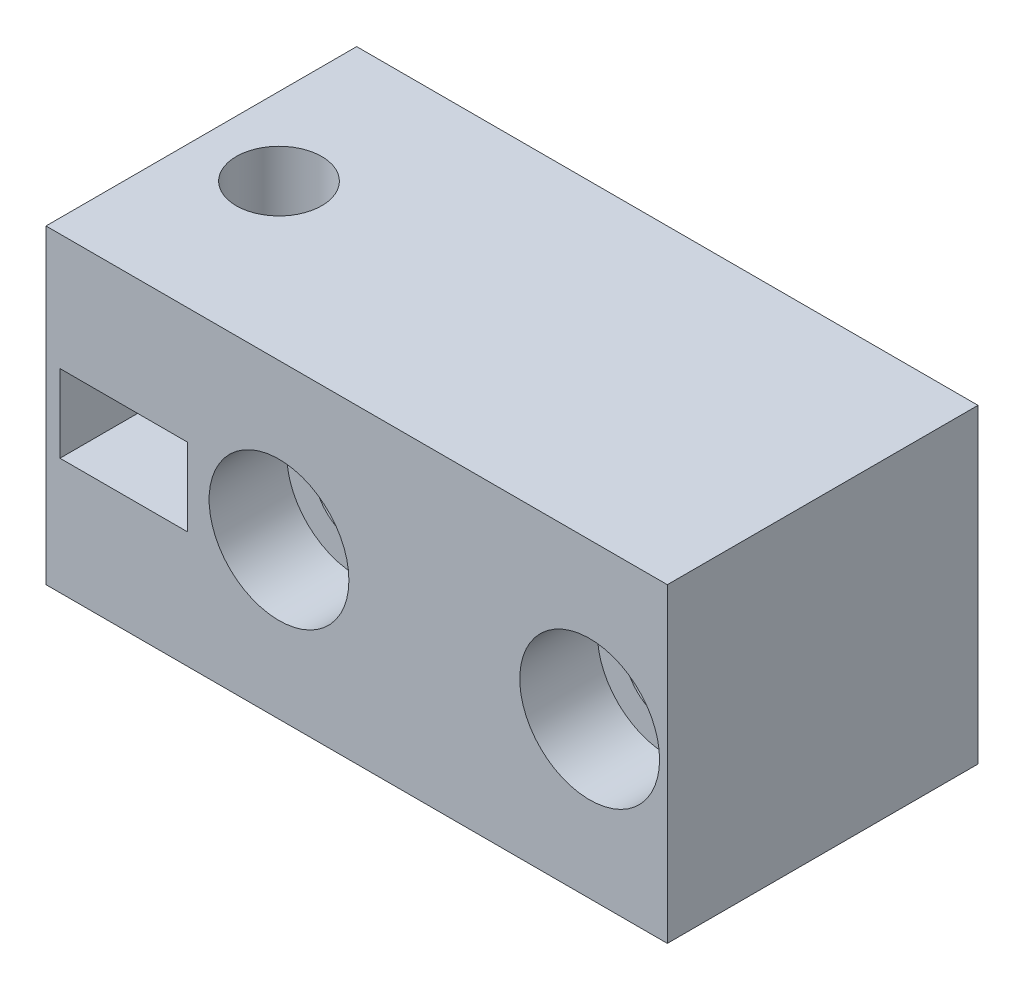
from build123d import *

# Parameters (mm, degrees)
SKETCH1_W           = 50
SKETCH1_H           = 20
BOSS_EXTRUDE1_DEPTH = 20
SKETCH2_R           = 2.75
SKETCH2_W           = 8.2
SKETCH2_H           = 5
CUT_EXTRUDE1_DEPTH  = 58.445626465
SKETCH3_R           = 2.75
CUT_EXTRUDE2_DEPTH  = 58.445626465
BOSS_EXTRUDE2_REACH = 57.283
SKETCH5_W           = 8
SKETCH5_H           = 6
BOSS_EXTRUDE3_DEPTH = 3
SKETCH6_R           = 4.5
CUT_EXTRUDE3_DEPTH  = 5
SKETCH7_W           = 10
SKETCH7_H           = 20
CUT_EXTRUDE4_DEPTH  = 59.557663888


with BuildPart() as part:
    # Sketch1 → Boss-Extrude1 (new body)
    with BuildSketch(Plane.XY):
        with Locations((25, 10)):
            Rectangle(SKETCH1_W, SKETCH1_H)
    extrude(amount=BOSS_EXTRUDE1_DEPTH)

    # Sketch2 → Cut-Extrude1 (cut, through all)
    with BuildSketch(Plane.XY.offset(20)):
        with Locations((25, 10)):
            Circle(SKETCH2_R)
        with Locations((45, 10)):
            Circle(SKETCH2_R)
        with Locations((15, 10)):
            Rectangle(SKETCH2_W, SKETCH2_H)
    extrude(amount=-CUT_EXTRUDE1_DEPTH, mode=Mode.SUBTRACT)

    # Sketch3 → Cut-Extrude2 (cut, through all)
    with BuildSketch(Plane(origin=(0, 20, 0), x_dir=(1, 0, 0), z_dir=(0, 1, 0))):
        with Locations((15, -10)):
            Circle(SKETCH3_R)
    extrude(amount=-CUT_EXTRUDE2_DEPTH, mode=Mode.SUBTRACT)

    # Sketch4 → Boss-Extrude2 (add, up to next)
    with BuildSketch(Plane(origin=(0, 7.5, 0), x_dir=(1, 0, 0), z_dir=(0, 1, 0)), mode=Mode.PRIVATE) as boss_extrude2_sk1:
        Polygon((19.1, -7.5), (15.1, -5.133920143), (10.9, -7.5), (10.9, 0), (19.1, 0), align=None)
    boss_extrude2_tool1 = extrude(boss_extrude2_sk1.sketch, amount=BOSS_EXTRUDE2_REACH, mode=Mode.PRIVATE) - part.part
    add(boss_extrude2_tool1.solids().sort_by_distance((14.993757, 7.5, 3.195407))[0])

    # Sketch5 → Boss-Extrude3 (add)
    with BuildSketch(Plane(origin=(0, 0, 0), x_dir=(-1, 0, 0), z_dir=(0, 0, -1))):
        with Locations((-35, 10)):
            Rectangle(SKETCH5_W, SKETCH5_H)
    extrude(amount=BOSS_EXTRUDE3_DEPTH)

    # Sketch6 → Cut-Extrude3 (cut)
    with BuildSketch(Plane.XY.offset(20)):
        with Locations((25, 10)):
            Circle(SKETCH6_R)
        with Locations((45, 10)):
            Circle(SKETCH6_R)
    extrude(amount=-CUT_EXTRUDE3_DEPTH, mode=Mode.SUBTRACT)

    # Sketch7 → Cut-Extrude4 (cut, through all)
    with BuildSketch(Plane.XY.offset(20)):
        with Locations((5, 10)):
            Rectangle(SKETCH7_W, SKETCH7_H)
    extrude(amount=-CUT_EXTRUDE4_DEPTH, mode=Mode.SUBTRACT)


solid = part.part
